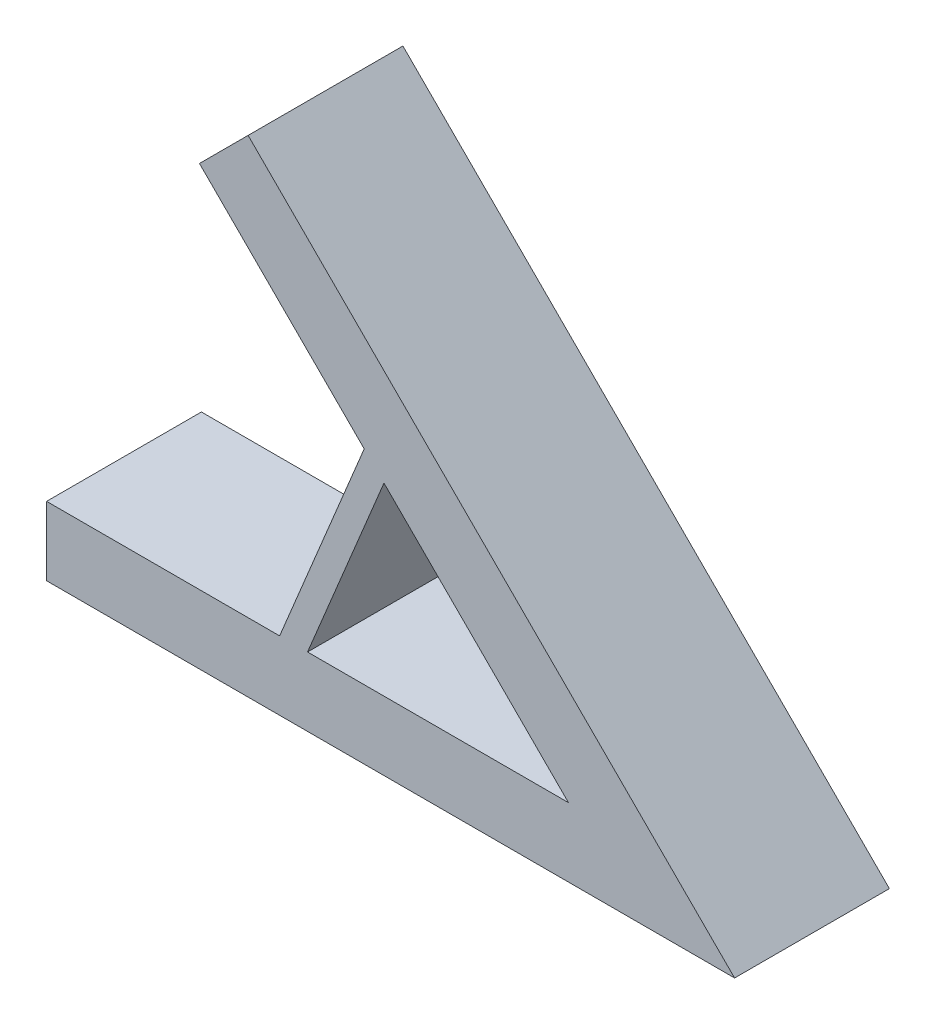
from build123d import *

# Parameters (mm, degrees)
EXTRUDE_1_DEPTH = 18


with BuildPart() as part:
    # 草图1 → 凸台-拉伸1 (new body)
    with BuildSketch(Plane.XY):
        Polygon((-80, 8), (-80, 0), (0, 0), (-56.568542495, 56.568542495), (-62.225396744, 50.911688245), (-43.065653216, 31.751944717), (-52.90403085, 8), align=None)
        Polygon((-19.313708499, 8), (-49.656854249, 8), (-40.769552622, 29.455844123), align=None, mode=Mode.SUBTRACT)
    extrude(amount=EXTRUDE_1_DEPTH)


solid = part.part
